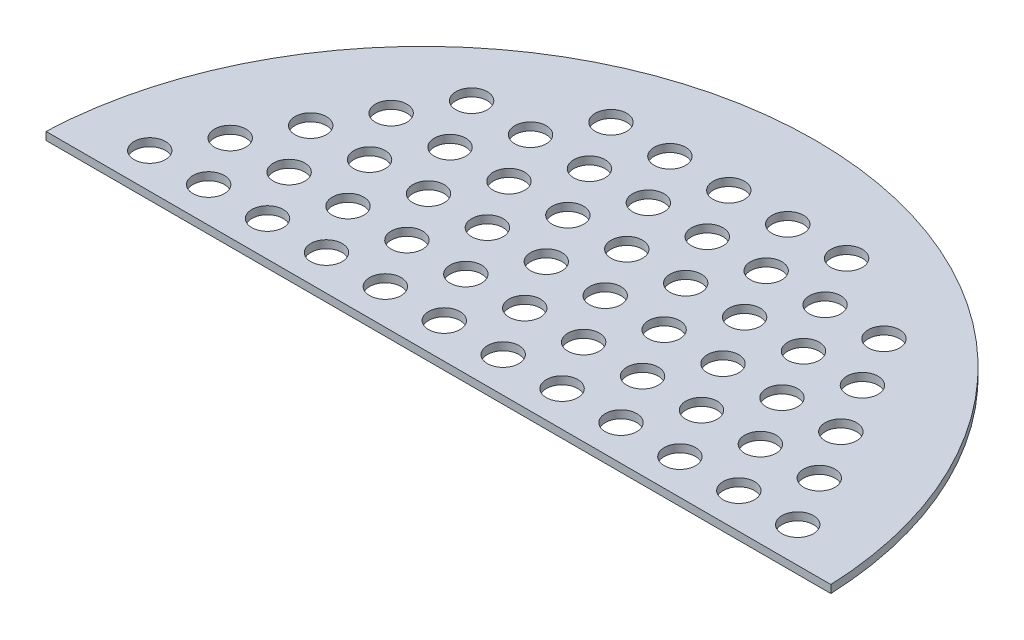
from build123d import *

# Parameters (mm, degrees)
SKETCH2_R               = 25.4
BOSS_EXTRUDE1_DEPTH     = 0.508
SKETCH3_R               = 1.016
CUT_EXTRUDE2_DEPTH      = 36.924616407
FILL_PATTERN1_OUTLINE_R = 1.016
FILL_PATTERN1_DEPTH     = 0.508
SKETCH7_W               = 63.5
SKETCH7_H               = 31.75
CUT_EXTRUDE5_DEPTH      = 36.924616407


# Read off the part's stored shape, not the designer's step: Fill Pattern1
with BuildPart() as part:
    # Sketch2 → Boss-Extrude1 (new body)
    with BuildSketch(Plane(origin=(0, 0, 0), x_dir=(1, 0, 0), z_dir=(0, 1, 0))):
        with Locations(Location((0, 0, 0), (0, 0, 270))):
            Circle(SKETCH2_R)
    extrude(amount=BOSS_EXTRUDE1_DEPTH)

    # Sketch3 → Cut-Extrude2 (cut, through all)
    with BuildSketch(Plane(origin=(0, 0.508, 0), x_dir=(1, 0, 0), z_dir=(0, 1, 0))):
        with Locations(Location((0, 0, 0), (0, 0, 270))):
            Circle(SKETCH3_R)
    extrude(amount=-CUT_EXTRUDE2_DEPTH, mode=Mode.SUBTRACT)

    # Fill Pattern1 outline → Fill Pattern1 (cut)
    with BuildSketch(Plane(origin=(0, 0, 0), x_dir=(1, 0, 0), z_dir=(0, 1, 0))):
        with Locations((20.955, -3.299556788)):
            Circle(FILL_PATTERN1_OUTLINE_R)
        with Locations((-11.43, -6.599113577)):
            Circle(FILL_PATTERN1_OUTLINE_R)
        with Locations((-13.335, -9.898670365)):
            Circle(FILL_PATTERN1_OUTLINE_R)
        with Locations((-15.24, -13.198227154)):
            Circle(FILL_PATTERN1_OUTLINE_R)
        with Locations((0, 19.797340731)):
            Circle(FILL_PATTERN1_OUTLINE_R)
        with Locations((-9.525, -3.299556788)):
            Circle(FILL_PATTERN1_OUTLINE_R)
        with Locations((-7.62, 0)):
            Circle(FILL_PATTERN1_OUTLINE_R)
        with Locations((-5.715, 3.299556788)):
            Circle(FILL_PATTERN1_OUTLINE_R)
        with Locations((-3.81, 6.599113577)):
            Circle(FILL_PATTERN1_OUTLINE_R)
        with Locations((-1.905, 16.497783942)):
            Circle(FILL_PATTERN1_OUTLINE_R)
        with Locations((-3.81, 13.198227154)):
            Circle(FILL_PATTERN1_OUTLINE_R)
        with Locations((-5.715, 9.898670365)):
            Circle(FILL_PATTERN1_OUTLINE_R)
        with Locations((-7.62, 6.599113577)):
            Circle(FILL_PATTERN1_OUTLINE_R)
        with Locations((-9.525, 3.299556788)):
            Circle(FILL_PATTERN1_OUTLINE_R)
        with Locations((-11.43, 0)):
            Circle(FILL_PATTERN1_OUTLINE_R)
        with Locations((-13.335, -3.299556788)):
            Circle(FILL_PATTERN1_OUTLINE_R)
        with Locations((-15.24, -6.599113577)):
            Circle(FILL_PATTERN1_OUTLINE_R)
        with Locations((7.62, 19.797340731)):
            Circle(FILL_PATTERN1_OUTLINE_R)
        with Locations((5.715, 16.497783942)):
            Circle(FILL_PATTERN1_OUTLINE_R)
        with Locations((3.81, 13.198227154)):
            Circle(FILL_PATTERN1_OUTLINE_R)
        with Locations((1.905, 9.898670365)):
            Circle(FILL_PATTERN1_OUTLINE_R)
        with Locations((0, 6.599113577)):
            Circle(FILL_PATTERN1_OUTLINE_R)
        with Locations((-1.905, 3.299556788)):
            Circle(FILL_PATTERN1_OUTLINE_R)
        with Locations((-3.81, 0)):
            Circle(FILL_PATTERN1_OUTLINE_R)
        with Locations((-5.715, -3.299556788)):
            Circle(FILL_PATTERN1_OUTLINE_R)
        with Locations((-7.62, -6.599113577)):
            Circle(FILL_PATTERN1_OUTLINE_R)
        with Locations((-9.525, -9.898670365)):
            Circle(FILL_PATTERN1_OUTLINE_R)
        with Locations((-11.43, -13.198227154)):
            Circle(FILL_PATTERN1_OUTLINE_R)
        with Locations((-13.335, -16.497783942)):
            Circle(FILL_PATTERN1_OUTLINE_R)
        with Locations((3.81, 19.797340731)):
            Circle(FILL_PATTERN1_OUTLINE_R)
        with Locations((1.905, 16.497783942)):
            Circle(FILL_PATTERN1_OUTLINE_R)
        with Locations((0, 13.198227154)):
            Circle(FILL_PATTERN1_OUTLINE_R)
        with Locations((-1.905, 9.898670365)):
            Circle(FILL_PATTERN1_OUTLINE_R)
        with Locations((-19.05, 0)):
            Circle(FILL_PATTERN1_OUTLINE_R)
        with Locations((-20.955, -3.299556788)):
            Circle(FILL_PATTERN1_OUTLINE_R)
        with Locations((-13.335, 16.497783942)):
            Circle(FILL_PATTERN1_OUTLINE_R)
        with Locations((-15.24, 13.198227154)):
            Circle(FILL_PATTERN1_OUTLINE_R)
        with Locations((-17.145, 9.898670365)):
            Circle(FILL_PATTERN1_OUTLINE_R)
        with Locations((-19.05, 6.599113577)):
            Circle(FILL_PATTERN1_OUTLINE_R)
        with Locations((-20.955, 3.299556788)):
            Circle(FILL_PATTERN1_OUTLINE_R)
        with Locations((-15.24, 0)):
            Circle(FILL_PATTERN1_OUTLINE_R)
        with Locations((-13.335, 3.299556788)):
            Circle(FILL_PATTERN1_OUTLINE_R)
        with Locations((-11.43, 6.599113577)):
            Circle(FILL_PATTERN1_OUTLINE_R)
        with Locations((-9.525, 9.898670365)):
            Circle(FILL_PATTERN1_OUTLINE_R)
        with Locations((-17.145, -9.898670365)):
            Circle(FILL_PATTERN1_OUTLINE_R)
        with Locations((-3.81, 19.797340731)):
            Circle(FILL_PATTERN1_OUTLINE_R)
        with Locations((-5.715, 16.497783942)):
            Circle(FILL_PATTERN1_OUTLINE_R)
        with Locations((-7.62, 13.198227154)):
            Circle(FILL_PATTERN1_OUTLINE_R)
        with Locations((-17.145, 3.299556788)):
            Circle(FILL_PATTERN1_OUTLINE_R)
        with Locations((-15.24, 6.599113577)):
            Circle(FILL_PATTERN1_OUTLINE_R)
        with Locations((-13.335, 9.898670365)):
            Circle(FILL_PATTERN1_OUTLINE_R)
        with Locations((-11.43, 13.198227154)):
            Circle(FILL_PATTERN1_OUTLINE_R)
        with Locations((-9.525, 16.497783942)):
            Circle(FILL_PATTERN1_OUTLINE_R)
        with Locations((-7.62, 19.797340731)):
            Circle(FILL_PATTERN1_OUTLINE_R)
        with Locations((-19.05, -6.599113577)):
            Circle(FILL_PATTERN1_OUTLINE_R)
        with Locations((-17.145, -3.299556788)):
            Circle(FILL_PATTERN1_OUTLINE_R)
        with Locations((3.81, -19.797340731)):
            Circle(FILL_PATTERN1_OUTLINE_R)
        with Locations((17.145, 9.898670365)):
            Circle(FILL_PATTERN1_OUTLINE_R)
        with Locations((15.24, 6.599113577)):
            Circle(FILL_PATTERN1_OUTLINE_R)
        with Locations((13.335, 3.299556788)):
            Circle(FILL_PATTERN1_OUTLINE_R)
        with Locations((5.715, -16.497783942)):
            Circle(FILL_PATTERN1_OUTLINE_R)
        with Locations((7.62, -13.198227154)):
            Circle(FILL_PATTERN1_OUTLINE_R)
        with Locations((9.525, -9.898670365)):
            Circle(FILL_PATTERN1_OUTLINE_R)
        with Locations((11.43, -6.599113577)):
            Circle(FILL_PATTERN1_OUTLINE_R)
        with Locations((3.81, -13.198227154)):
            Circle(FILL_PATTERN1_OUTLINE_R)
        with Locations((1.905, -16.497783942)):
            Circle(FILL_PATTERN1_OUTLINE_R)
        with Locations((0, -19.797340731)):
            Circle(FILL_PATTERN1_OUTLINE_R)
        with Locations((15.24, 13.198227154)):
            Circle(FILL_PATTERN1_OUTLINE_R)
        with Locations((5.715, -9.898670365)):
            Circle(FILL_PATTERN1_OUTLINE_R)
        with Locations((7.62, -6.599113577)):
            Circle(FILL_PATTERN1_OUTLINE_R)
        with Locations((9.525, -3.299556788)):
            Circle(FILL_PATTERN1_OUTLINE_R)
        with Locations((11.43, 0)):
            Circle(FILL_PATTERN1_OUTLINE_R)
        with Locations((15.24, -6.599113577)):
            Circle(FILL_PATTERN1_OUTLINE_R)
        with Locations((17.145, -3.299556788)):
            Circle(FILL_PATTERN1_OUTLINE_R)
        with Locations((19.05, 0)):
            Circle(FILL_PATTERN1_OUTLINE_R)
        with Locations((20.955, 3.299556788)):
            Circle(FILL_PATTERN1_OUTLINE_R)
        with Locations((13.335, -16.497783942)):
            Circle(FILL_PATTERN1_OUTLINE_R)
        with Locations((15.24, -13.198227154)):
            Circle(FILL_PATTERN1_OUTLINE_R)
        with Locations((17.145, -9.898670365)):
            Circle(FILL_PATTERN1_OUTLINE_R)
        with Locations((19.05, -6.599113577)):
            Circle(FILL_PATTERN1_OUTLINE_R)
        with Locations((13.335, -9.898670365)):
            Circle(FILL_PATTERN1_OUTLINE_R)
        with Locations((11.43, -13.198227154)):
            Circle(FILL_PATTERN1_OUTLINE_R)
        with Locations((9.525, -16.497783942)):
            Circle(FILL_PATTERN1_OUTLINE_R)
        with Locations((7.62, -19.797340731)):
            Circle(FILL_PATTERN1_OUTLINE_R)
        with Locations((19.05, 6.599113577)):
            Circle(FILL_PATTERN1_OUTLINE_R)
        with Locations((17.145, 3.299556788)):
            Circle(FILL_PATTERN1_OUTLINE_R)
        with Locations((15.24, 0)):
            Circle(FILL_PATTERN1_OUTLINE_R)
        with Locations((13.335, -3.299556788)):
            Circle(FILL_PATTERN1_OUTLINE_R)
        with Locations((7.62, 13.198227154)):
            Circle(FILL_PATTERN1_OUTLINE_R)
        with Locations((9.525, 16.497783942)):
            Circle(FILL_PATTERN1_OUTLINE_R)
        with Locations((-7.62, -19.797340731)):
            Circle(FILL_PATTERN1_OUTLINE_R)
        with Locations((-5.715, -16.497783942)):
            Circle(FILL_PATTERN1_OUTLINE_R)
        with Locations((-3.81, -13.198227154)):
            Circle(FILL_PATTERN1_OUTLINE_R)
        with Locations((-1.905, -9.898670365)):
            Circle(FILL_PATTERN1_OUTLINE_R)
        with Locations((0, -6.599113577)):
            Circle(FILL_PATTERN1_OUTLINE_R)
        with Locations((1.905, -3.299556788)):
            Circle(FILL_PATTERN1_OUTLINE_R)
        with Locations((5.715, 9.898670365)):
            Circle(FILL_PATTERN1_OUTLINE_R)
        with Locations((3.81, 6.599113577)):
            Circle(FILL_PATTERN1_OUTLINE_R)
        with Locations((1.905, 3.299556788)):
            Circle(FILL_PATTERN1_OUTLINE_R)
        with Locations((-1.905, -3.299556788)):
            Circle(FILL_PATTERN1_OUTLINE_R)
        with Locations((-3.81, -6.599113577)):
            Circle(FILL_PATTERN1_OUTLINE_R)
        with Locations((-5.715, -9.898670365)):
            Circle(FILL_PATTERN1_OUTLINE_R)
        with Locations((-7.62, -13.198227154)):
            Circle(FILL_PATTERN1_OUTLINE_R)
        with Locations((-9.525, -16.497783942)):
            Circle(FILL_PATTERN1_OUTLINE_R)
        with Locations((13.335, 9.898670365)):
            Circle(FILL_PATTERN1_OUTLINE_R)
        with Locations((11.43, 6.599113577)):
            Circle(FILL_PATTERN1_OUTLINE_R)
        with Locations((9.525, 3.299556788)):
            Circle(FILL_PATTERN1_OUTLINE_R)
        with Locations((7.62, 0)):
            Circle(FILL_PATTERN1_OUTLINE_R)
        with Locations((5.715, -3.299556788)):
            Circle(FILL_PATTERN1_OUTLINE_R)
        with Locations((3.81, -6.599113577)):
            Circle(FILL_PATTERN1_OUTLINE_R)
        with Locations((1.905, -9.898670365)):
            Circle(FILL_PATTERN1_OUTLINE_R)
        with Locations((0, -13.198227154)):
            Circle(FILL_PATTERN1_OUTLINE_R)
        with Locations((3.81, 0)):
            Circle(FILL_PATTERN1_OUTLINE_R)
        with Locations((5.715, 3.299556788)):
            Circle(FILL_PATTERN1_OUTLINE_R)
        with Locations((7.62, 6.599113577)):
            Circle(FILL_PATTERN1_OUTLINE_R)
        with Locations((9.525, 9.898670365)):
            Circle(FILL_PATTERN1_OUTLINE_R)
        with Locations((11.43, 13.198227154)):
            Circle(FILL_PATTERN1_OUTLINE_R)
        with Locations((13.335, 16.497783942)):
            Circle(FILL_PATTERN1_OUTLINE_R)
        with Locations((-3.81, -19.797340731)):
            Circle(FILL_PATTERN1_OUTLINE_R)
        with Locations((-1.905, -16.497783942)):
            Circle(FILL_PATTERN1_OUTLINE_R)
    extrude(amount=FILL_PATTERN1_DEPTH, mode=Mode.SUBTRACT)

    # Sketch7 → Cut-Extrude5 (cut, through all)
    with BuildSketch(Plane(origin=(0, 0.508, 0), x_dir=(1, 0, 0), z_dir=(0, 1, 0))):
        with Locations((0, -14.859)):
            Rectangle(SKETCH7_W, SKETCH7_H)
    extrude(amount=-CUT_EXTRUDE5_DEPTH, mode=Mode.SUBTRACT)


solid = part.part
